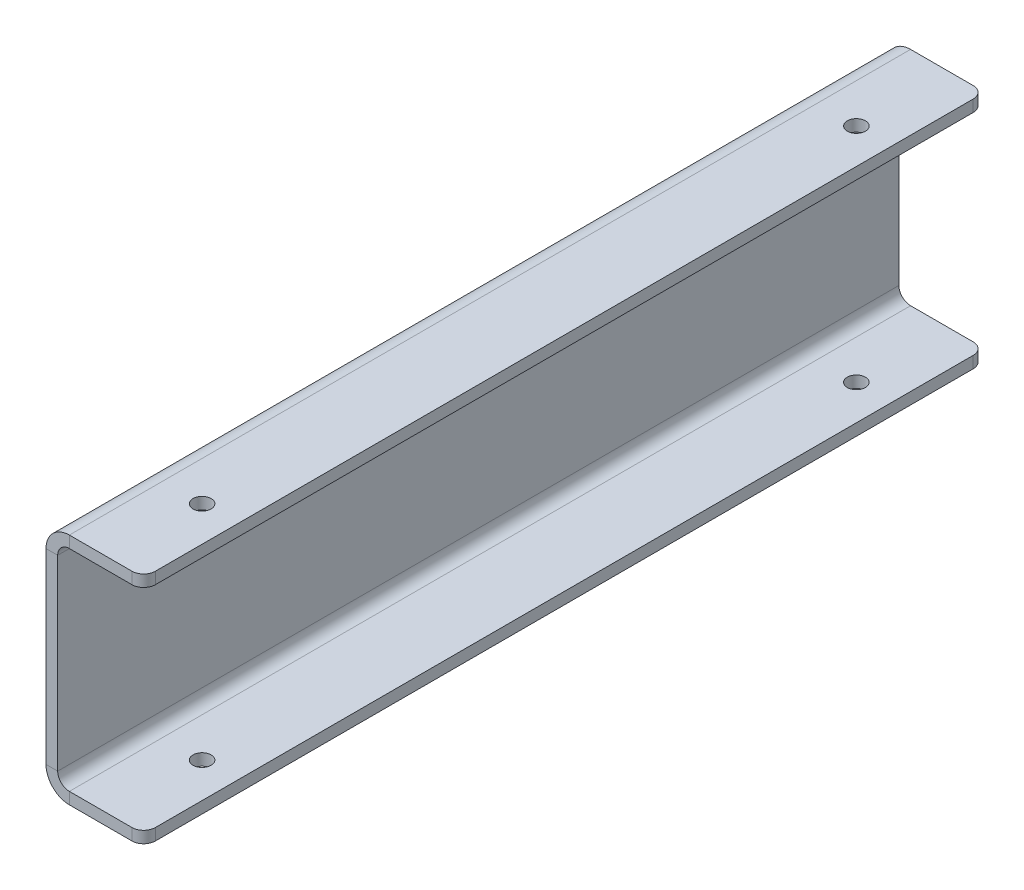
from build123d import *

# Parameters (mm, degrees)
SKETCH1_W                      = 228.6
SKETCH1_H                      = 63.5
BASE_FLANGE1_DEPTH             = 3.175
EDGE_FLANGE1_STRIP_W           = 19.05
EDGE_FLANGE1_STRIP_H           = 3.175
EDGE_FLANGE1_STRIP_CUT_DEPTH   = 228.6
EDGE_FLANGE1_STRIP_2_W         = 19.05
EDGE_FLANGE1_STRIP_2_H         = 3.175
EDGE_FLANGE1_STRIP_CUT_2_DEPTH = 228.6
EDGE_FLANGE1_DEPTH             = 228.6
EDGE_FLANGE1_BEND_DEPTH        = 228.6
SKETCH12_R                     = 2.45745
CUT_EXTRUDE1_DEPTH             = 239.403593564
FILLET1_R                      = 3.175


# Sheet-metal steps are written as plain solids
with BuildPart() as part:
    # Sketch1 → Base-Flange1 (new body)
    with BuildSketch(Plane(origin=(0, 0, 0), x_dir=(0, 0, -1), z_dir=(1, 0, 0))):
        with Locations((114.3, 31.75)):
            Rectangle(SKETCH1_W, SKETCH1_H)
    extrude(amount=-BASE_FLANGE1_DEPTH)

    # Edge-Flange1 strip (across the edge) → Edge-Flange1 strip cut (cut)
    with BuildSketch(Plane(origin=(0, 63.5, -228.6), x_dir=(0, -1, 0), z_dir=(0, 0, 1))):
        with Locations((-3.175, -1.5875)):
            Rectangle(EDGE_FLANGE1_STRIP_W, EDGE_FLANGE1_STRIP_H)
    extrude(amount=EDGE_FLANGE1_STRIP_CUT_DEPTH, mode=Mode.SUBTRACT)

    # Edge-Flange1 strip 2 (across the edge) → Edge-Flange1 strip cut 2 (cut)
    with BuildSketch(Plane.YX):
        with Locations((-3.175, -1.5875)):
            Rectangle(EDGE_FLANGE1_STRIP_2_W, EDGE_FLANGE1_STRIP_2_H)
    extrude(amount=EDGE_FLANGE1_STRIP_CUT_2_DEPTH, mode=Mode.SUBTRACT)

    # Edge-Flange1 section (across the edge) → Edge-Flange1 (add)
    with BuildSketch(Plane(origin=(0, 63.5, -228.6), x_dir=(0, -1, 0), z_dir=(0, 0, 1))):
        with BuildLine():
            Line((0, 3.175), (0, 23.368))
            Line((0, 23.368), (3.175, 23.368))
            Line((3.175, 23.368), (3.175, 3.175))
            ThreePointArc((3.175, 3.175), (4.10493597, 0.92993597), (6.35, 0))
            Line((6.35, 0), (6.35, -3.175))
            ThreePointArc((6.35, -3.175), (1.859871939, -1.315128061), (0, 3.175))
        make_face()
    extrude(amount=EDGE_FLANGE1_DEPTH)

    # Edge-Flange1 section 2 (across the edge) → Edge-Flange1 bend (add)
    with BuildSketch(Plane.YX):
        with BuildLine():
            Line((0, 3.175), (0, 23.368))
            Line((0, 23.368), (3.175, 23.368))
            Line((3.175, 23.368), (3.175, 3.175))
            ThreePointArc((3.175, 3.175), (4.10493597, 0.92993597), (6.35, 0))
            Line((6.35, 0), (6.35, -3.175))
            ThreePointArc((6.35, -3.175), (1.859871939, -1.315128061), (0, 3.175))
        make_face()
    extrude(amount=EDGE_FLANGE1_BEND_DEPTH)

    # Sketch12 → Cut-Extrude1 (cut, through all)
    with BuildSketch(Plane(origin=(0, 63.5, 0), x_dir=(1, 0, 0), z_dir=(0, 1, 0))):
        with Locations(Location((13.843, 203.2, 0), (0, 0, 180))):
            Circle(SKETCH12_R)
        with Locations(Location((13.843, 25.4, 0), (0, 0, 180))):
            Circle(SKETCH12_R)
    extrude(amount=-CUT_EXTRUDE1_DEPTH, mode=Mode.SUBTRACT)

    # Fillet1
    fillet1_edges = [part.edges().sort_by_distance(p)[0] for p in [
        (23.368, 61.9125, -228.6),
        (23.368, 61.9125, 0),
        (23.368, 1.5875, 0),
        (23.368, 1.5875, -228.6),
    ]]
    fillet(fillet1_edges, radius=FILLET1_R)


solid = part.part
